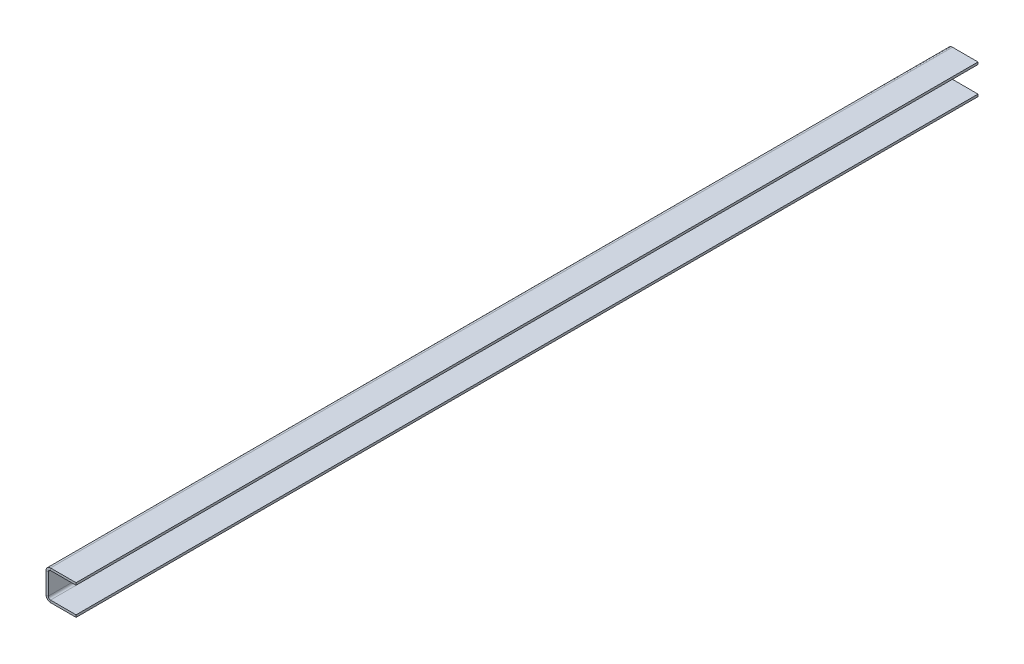
from build123d import *

# Parameters (mm, degrees)
SM_BASE_FLANGE_1_DEPTH = 300


# Sheet-metal steps are written as plain solids
with BuildPart() as part:
    # Sketch 1 → Базовая кромка1 (new, symmetric)
    with BuildSketch(Plane.XY):
        with BuildLine():
            Line((20, 20), (3, 20))
            ThreePointArc((3, 20), (0.878679656, 19.121320344), (0, 17))
            Line((0, 17), (0, 3))
            ThreePointArc((0, 3), (0.878679656, 0.878679656), (3, 0))
            Line((3, 0), (20, 0))
            Line((20, 0), (20, 1.5))
            Line((20, 1.5), (3, 1.5))
            ThreePointArc((3, 1.5), (1.939339828, 1.939339828), (1.5, 3))
            Line((1.5, 3), (1.5, 17))
            ThreePointArc((1.5, 17), (1.939339828, 18.060660172), (3, 18.5))
            Line((3, 18.5), (20, 18.5))
            Line((20, 18.5), (20, 20))
        make_face()
    extrude(amount=SM_BASE_FLANGE_1_DEPTH, both=True)


solid = part.part
